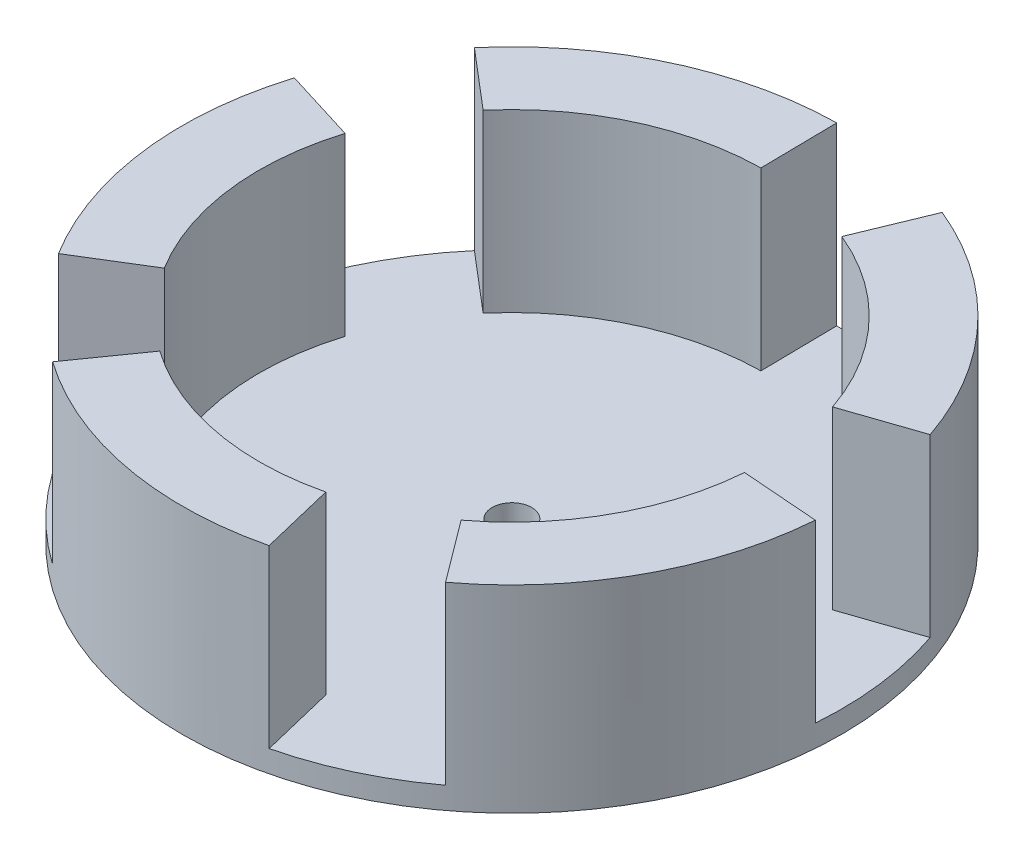
from build123d import *

# Parameters (mm, degrees)
SKETCH3_R           = 30
BOSS_EXTRUDE3_DEPTH = 2
BOSS_EXTRUDE4_DEPTH = 16
SKETCH5_R           = 8.5
BOSS_EXTRUDE5_DEPTH = 8
SKETCH6_R           = 1.8
CUT_EXTRUDE1_DEPTH  = 5
FILLET1_R           = 2


with BuildPart() as part:
    # Sketch3 → Boss-Extrude3 (new body)
    with BuildSketch(Plane(origin=(0, 0, 0), x_dir=(1, 0, 0), z_dir=(0, 1, 0))):
        Circle(SKETCH3_R)
    extrude(amount=BOSS_EXTRUDE3_DEPTH)

    # Sketch4 → Boss-Extrude4 (add)
    with BuildSketch(Plane(origin=(0, 2, 0), x_dir=(1, 0, 0), z_dir=(0, 1, 0))):
        with BuildLine():
            Line((13.78431234, -18.411755303), (17.979537834, -24.015333004))
            ThreePointArc((17.979537834, -24.015333004), (26.293545079, -14.444704468), (29.912119786, -2.294578373))
            Line((29.912119786, -2.294578373), (22.932625169, -1.759176753))
            ThreePointArc((22.932625169, -1.759176753), (20.158384561, -11.074273425), (13.78431234, -18.411755303))
        make_face()
        with BuildLine():
            Line((21.770206626, 7.420114788), (28.395921686, 9.678410593))
            ThreePointArc((28.395921686, 9.678410593), (21.862882582, 20.542988225), (11.425627065, 27.739052727))
            Line((11.425627065, 27.739052727), (8.759647417, 21.26660709))
            ThreePointArc((8.759647417, 21.26660709), (16.761543313, 15.749624306), (21.770206626, 7.420114788))
        make_face()
        with BuildLine():
            Line((-0.329584703, 22.997638442), (-0.42989309, 29.996919707))
            ThreePointArc((-0.42989309, 29.996919707), (-12.781540551, 27.140969421), (-22.850693917, 19.438255774))
            Line((-22.850693917, 19.438255774), (-17.518865336, 14.90266276))
            ThreePointArc((-17.518865336, 14.90266276), (-9.799181089, 20.808076556), (-0.329584703, 22.997638442))
        make_face()
        with BuildLine():
            Line((-21.973901174, 6.79320743), (-28.661610227, 8.860705343))
            ThreePointArc((-28.661610227, 8.860705343), (-29.762309071, -3.768946635), (-25.548132572, -15.725549976))
            Line((-25.548132572, -15.725549976), (-19.586901639, -12.056254982))
            ThreePointArc((-19.586901639, -12.056254982), (-22.817770288, -2.889525753), (-21.973901174, 6.79320743))
        make_face()
        with BuildLine():
            Line((-13.251033088, -18.799205358), (-17.283956202, -24.520702641))
            ThreePointArc((-17.283956202, -24.520702641), (-5.612578038, -29.470306543), (7.061079638, -29.157180151))
            Line((7.061079638, -29.157180151), (5.413494389, -22.353838116))
            ThreePointArc((5.413494389, -22.353838116), (-4.302976496, -22.593901683), (-13.251033088, -18.799205358))
        make_face()
    extrude(amount=BOSS_EXTRUDE4_DEPTH)

    # Sketch5 → Boss-Extrude5 (add)
    with BuildSketch(Plane.XZ):
        Circle(SKETCH5_R)
        Polygon((7.347174402, -0.795211696), (4.362260731, 5.96523383), (-2.984913671, 6.760445526), (-7.347174402, 0.795211696), (-4.362260731, -5.96523383), (2.984913671, -6.760445526), align=None, mode=Mode.SUBTRACT)
    extrude(amount=BOSS_EXTRUDE5_DEPTH)

    # Sketch6 → Cut-Extrude1 (cut)
    with BuildSketch(Plane.XZ):
        Circle(SKETCH6_R)
    extrude(amount=-CUT_EXTRUDE1_DEPTH, mode=Mode.SUBTRACT)

    # Fillet1
    fillet1_edges = [part.edges().sort_by_distance(p)[0] for p in [
        (-8.5, 0, 0),
    ]]
    fillet(fillet1_edges, radius=FILLET1_R)


solid = part.part
